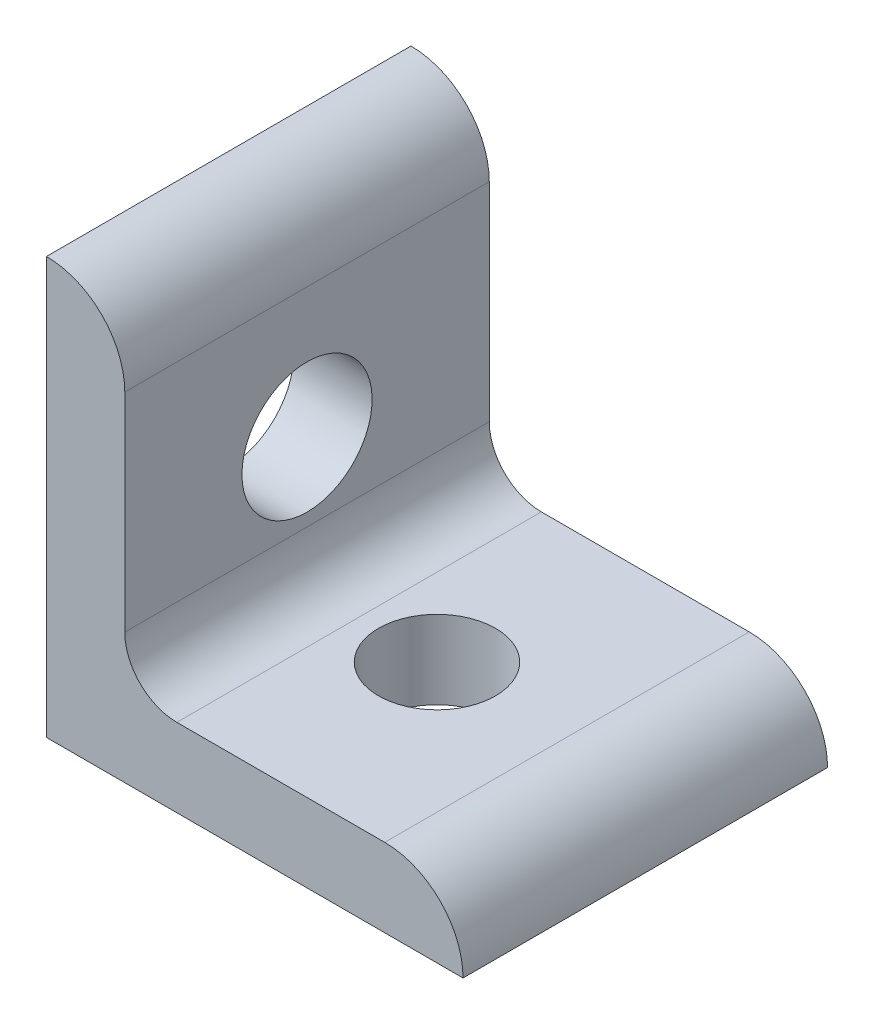
from build123d import *

# Parameters (mm, degrees)
BOSS_EXTRUDE1_DEPTH         = 11.1125
SKETCH2_R                   = 3.5687
CUT_EXTRUDE1_DEPTH          = 38.600633721
SKETCH3_R                   = 3.5687
CUT_EXTRUDE2_DEPTH          = 38.600633721
F_3_8_16_TAPPED_HOLE1_D     = 7.9375
F_3_8_16_TAPPED_HOLE1_DEPTH = 23.8125
F_3_8_16_TAPPED_HOLE1_TIP   = 2.384665582


with BuildPart() as part:
    # Sketch1 → Boss-Extrude1 (new, symmetric)
    with BuildSketch(Plane.XY):
        with BuildLine():
            Line((0, 0), (0, 25.4))
            ThreePointArc((0, 25.4), (3.376576302, 24.001376302), (4.7752, 20.6248))
            Line((4.7752, 20.6248), (4.7752, 7.9502))
            ThreePointArc((4.7752, 7.9502), (5.70513597, 5.70513597), (7.9502, 4.7752))
            Line((7.9502, 4.7752), (20.6248, 4.7752))
            ThreePointArc((20.6248, 4.7752), (24.001376302, 3.376576302), (25.4, 0))
            Line((25.4, 0), (0, 0))
        make_face()
    extrude(amount=BOSS_EXTRUDE1_DEPTH, both=True)

    # Sketch2 → Cut-Extrude1 (cut, through all)
    with BuildSketch(Plane(origin=(0, 0, 0), x_dir=(1, 0, 0), z_dir=(0, 1, 0))):
        with Locations((12.7, 0)):
            Circle(SKETCH2_R)
    extrude(amount=CUT_EXTRUDE1_DEPTH, mode=Mode.SUBTRACT)

    # Sketch3 → Cut-Extrude2 (cut, through all)
    with BuildSketch(Plane(origin=(0, 0, 0), x_dir=(0, 0, -1), z_dir=(1, 0, 0))):
        with Locations((0, 12.7)):
            Circle(SKETCH3_R)
    extrude(amount=CUT_EXTRUDE2_DEPTH, mode=Mode.SUBTRACT)

    # 3/8-16 Tapped Hole1
    with Locations(Plane.ZY):
        with Locations((0, 12.7)):
            Hole(F_3_8_16_TAPPED_HOLE1_D / 2, depth=F_3_8_16_TAPPED_HOLE1_DEPTH)
            with Locations((0, 0, -(F_3_8_16_TAPPED_HOLE1_DEPTH + F_3_8_16_TAPPED_HOLE1_TIP / 2))):  # 118° drill point
                Cone(0, F_3_8_16_TAPPED_HOLE1_D / 2, F_3_8_16_TAPPED_HOLE1_TIP, mode=Mode.SUBTRACT)


solid = part.part
